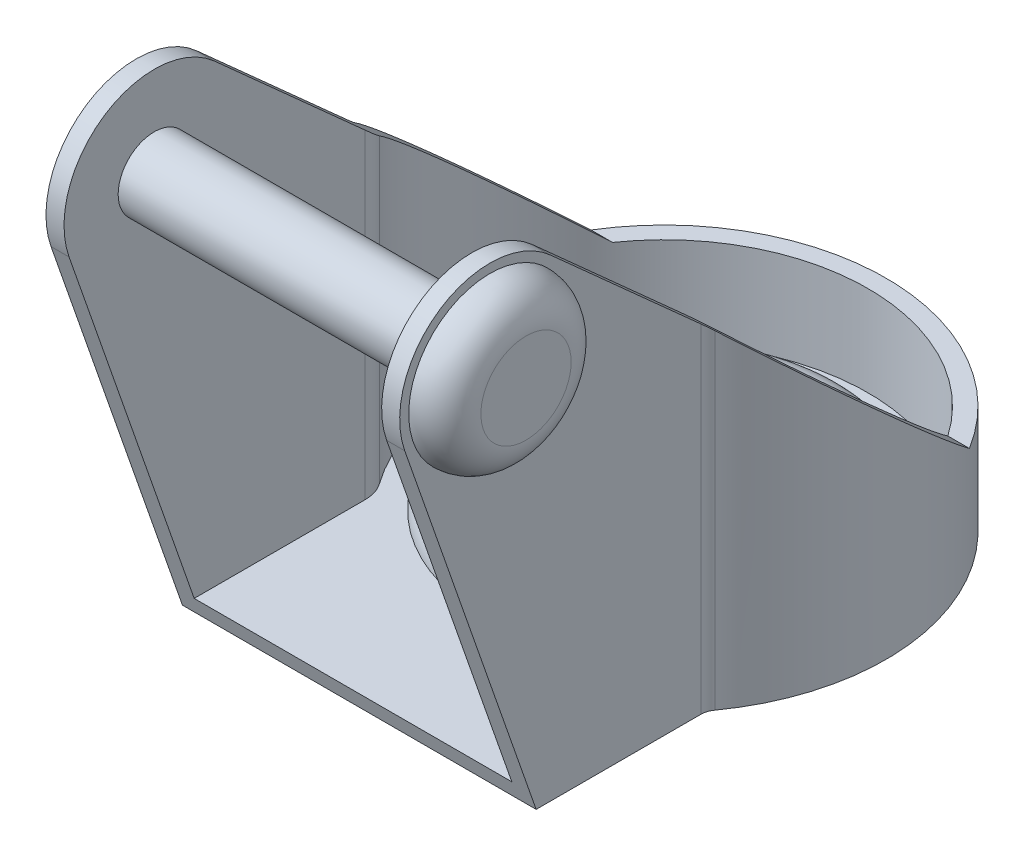
from build123d import *

# Parameters (mm, degrees)
BOSS_EXTRUDE3_DEPTH     = 1
BOSS_EXTRUDE4_DEPTH     = 19.6
CUT_EXTRUDE3_START      = -1
CUT_EXTRUDE3_DEPTH      = 38.799803657
BOSS_EXTRUDE5_DEPTH     = 30
CUT_EXTRUDE4_DEPTH      = 42.354259319
CUT_EXTRUDE4_DEPTH_BACK = 42.354259319
SKETCH9_R               = 2
BOSS_EXTRUDE6_DEPTH     = 17.6
SKETCH10_R              = 3.55
BOSS_EXTRUDE7_DEPTH     = 1
SKETCH11_R              = 1.8
CUT_EXTRUDE5_DEPTH      = 2
SKETCH12_R              = 4.5
BOSS_EXTRUDE8_DEPTH     = 2
SKETCH13_R              = 10.05
SKETCH13_R_2            = 5.1
BOSS_EXTRUDE9_DEPTH     = 2
SKETCH14_R              = 2.6
CUT_EXTRUDE6_DEPTH      = 39.097569002
FILLET2_R               = 2
FILLET3_R               = 2
FILLET4_R               = 2
FILLET5_R               = 2


# Some blends are built 0.0001 mm under size
with BuildPart() as part:
    # Sketch1 → Boss-Extrude3 (new body)
    # profile 1 of 2: a face of its own
    with BuildSketch(Plane(origin=(0, 0, 0), x_dir=(1, 0, 0), z_dir=(0, 1, 0))):
        with BuildLine():
            Line((9.8, -7.762087348), (9.8, -16.888723439))
            Line((9.8, -16.888723439), (-9.8, -16.888723439))
            Line((-9.8, -16.888723439), (-9.8, -7.762087348))
            ThreePointArc((-9.8, -7.762087348), (-9.848151778, -7.455517678), (-9.987969925, -7.178471758))
            ThreePointArc((-9.987969925, -7.178471758), (0, 12.3), (9.987969925, -7.178471758))
            ThreePointArc((9.987969925, -7.178471758), (9.848151778, -7.455517678), (9.8, -7.762087348))
        make_face()
        with BuildLine():
            ThreePointArc((8.8, -7.762087348), (8.896303556, -7.148948009), (9.17593985, -6.594856168))
            ThreePointArc((9.17593985, -6.594856168), (0, 11.3), (-9.17593985, -6.594856168))
            ThreePointArc((-9.17593985, -6.594856168), (-8.896303556, -7.148948009), (-8.8, -7.762087348))
            Line((-8.8, -7.762087348), (-8.8, -15.888723439))
            Line((-8.8, -15.888723439), (8.8, -15.888723439))
            Line((8.8, -15.888723439), (8.8, -7.762087348))
        make_face(mode=Mode.SUBTRACT)
    # profile 2 of 2: a face of its own
    with BuildSketch(Plane(origin=(0, 0, 0), x_dir=(1, 0, 0), z_dir=(0, 1, 0))):
        with BuildLine():
            Line((8.8, -7.762087348), (8.8, -15.888723439))
            Line((8.8, -15.888723439), (-8.8, -15.888723439))
            Line((-8.8, -15.888723439), (-8.8, -7.762087348))
            ThreePointArc((-8.8, -7.762087348), (-8.896303556, -7.148948009), (-9.17593985, -6.594856168))
            ThreePointArc((-9.17593985, -6.594856168), (0, 11.3), (9.17593985, -6.594856168))
            ThreePointArc((9.17593985, -6.594856168), (8.896303556, -7.148948009), (8.8, -7.762087348))
        make_face()
    extrude(amount=BOSS_EXTRUDE3_DEPTH)

    # Sketch2 → Boss-Extrude4 (add)
    with BuildSketch(Plane.ZY.offset(9.8)):
        with BuildLine():
            Line((16.888723439, 0), (24.17200628, 20.851200177))
            ThreePointArc((24.17200628, 20.851200177), (22.22483795, 26.660481625), (16.113586017, 26.22251443))
            Line((16.113586017, 26.22251443), (7.762087348, 18.73346191))
            Line((7.762087348, 18.73346191), (7.762087348, 0))
            Line((7.762087348, 0), (16.888723439, 0))
        make_face()
    extrude(amount=-BOSS_EXTRUDE4_DEPTH)

    # Sketch4 → Cut-Extrude3 (cut, through all)
    with BuildSketch(Plane.XZ.offset(CUT_EXTRUDE3_START)):
        Polygon((8.8, 7.762087348), (8.8, 15.888723439), (8.8, 29.007134954), (-8.8, 29.007134954), (-8.8, 15.888723439), (-8.8, 7.762087348), align=None)
    extrude(amount=-CUT_EXTRUDE3_DEPTH, mode=Mode.SUBTRACT)

    # Sketch5 → Boss-Extrude5 (add)
    with BuildSketch(Plane(origin=(0, 1, 0), x_dir=(1, 0, 0), z_dir=(0, 1, 0))):
        with BuildLine():
            Line((-8.8, -7.762087348), (-9.8, -7.762087348))
            ThreePointArc((-9.8, -7.762087348), (-9.848151778, -7.455517678), (-9.987969925, -7.178471758))
            ThreePointArc((-9.987969925, -7.178471758), (0, 12.3), (9.987969925, -7.178471758))
            ThreePointArc((9.987969925, -7.178471758), (9.848151778, -7.455517678), (9.8, -7.762087348))
            Line((9.8, -7.762087348), (8.8, -7.762087348))
            ThreePointArc((8.8, -7.762087348), (8.896303556, -7.148948009), (9.17593985, -6.594856168))
            ThreePointArc((9.17593985, -6.594856168), (0, 11.3), (-9.17593985, -6.594856168))
            ThreePointArc((-9.17593985, -6.594856168), (-8.896303556, -7.148948009), (-8.8, -7.762087348))
        make_face()
    extrude(amount=BOSS_EXTRUDE5_DEPTH)

    # Sketch7 → Cut-Extrude4 (cut, two sides: drawn at the far end of the back side and taken through both)
    with BuildSketch(Plane(origin=(0, 0, 0), x_dir=(0, 0, -1), z_dir=(1, 0, 0)).offset(-CUT_EXTRUDE4_DEPTH_BACK)):
        Polygon((15.143665649, 54.023758671), (-16.113586017, 54.023758671), (-16.113586017, 26.22251443), (-7.762087348, 18.73346191), (6.433392437, 6.003927025), (15.143665649, 6.003927025), align=None)
    extrude(amount=CUT_EXTRUDE4_DEPTH + CUT_EXTRUDE4_DEPTH_BACK, mode=Mode.SUBTRACT)

    # Sketch9 → Boss-Extrude6 (add)
    with BuildSketch(Plane(origin=(-8.8, 0, 0), x_dir=(0, 0, -1), z_dir=(1, 0, 0))):
        with Locations(Location((-19.451682229, 22.5, 0), (0, 0, 180))):
            Circle(SKETCH9_R)
    extrude(amount=BOSS_EXTRUDE6_DEPTH)

    # Sketch10 → Boss-Extrude7 (add)
    with BuildSketch(Plane.ZY.offset(9.8)):
        with Locations(Location((19.451682229, 22.5, 0), (0, 0, 180))):
            Circle(SKETCH10_R)
    extrude(amount=BOSS_EXTRUDE7_DEPTH)

    # Sketch11 → Cut-Extrude5 (cut)
    with BuildSketch(Plane.ZY.offset(10.8)):
        with Locations((19.451682229, 22.5)):
            Circle(SKETCH11_R)
    extrude(amount=-CUT_EXTRUDE5_DEPTH, mode=Mode.SUBTRACT)

    # Sketch12 → Boss-Extrude8 (add)
    with BuildSketch(Plane(origin=(9.8, 0, 0), x_dir=(0, 0, -1), z_dir=(1, 0, 0))):
        with Locations((-19.451682229, 22.5)):
            Circle(SKETCH12_R)
    extrude(amount=BOSS_EXTRUDE8_DEPTH)

    # Sketch13 → Boss-Extrude9 (add)
    with BuildSketch(Plane(origin=(0, 1, 0), x_dir=(1, 0, 0), z_dir=(0, 1, 0))):
        with Locations(Location((0, 0, 0), (0, 0, 270))):
            Circle(SKETCH13_R)
        with Locations(Location((0, 0, 0), (0, 0, 270))):
            Circle(SKETCH13_R_2, mode=Mode.SUBTRACT)
    extrude(amount=BOSS_EXTRUDE9_DEPTH)

    # Sketch14 → Cut-Extrude6 (cut, through all)
    with BuildSketch(Plane(origin=(0, 1, 0), x_dir=(1, 0, 0), z_dir=(0, 1, 0))):
        with Locations(Location((0, 0, 0), (0, 0, 270))):
            Circle(SKETCH14_R)
    extrude(amount=-CUT_EXTRUDE6_DEPTH, mode=Mode.SUBTRACT)

    # Fillet2
    fillet2_edges = [part.edges().sort_by_distance(p)[0] for p in [
        (0, 3, -5.1),
    ]]
    fillet(fillet2_edges, radius=FILLET2_R - 0.0001)  # a hair under: the kernel refuses the full size

    # Fillet3
    fillet3_edges = [part.edges().sort_by_distance(p)[0] for p in [
        (0, 3, -10.05),
    ]]
    fillet(fillet3_edges, radius=FILLET3_R - 0.0001)  # a hair under: the kernel refuses the full size

    # Fillet4
    # the kernel refuses this fillet: 2 mm, written as the material it takes off along each edge
    with BuildSketch(Plane(origin=(-10.8, 22.5, 19.451682229), x_dir=(0, 0, -1), z_dir=(0, 1, 0))) as fillet4_piece_1:
        with BuildLine():
            CenterArc((1.817949192, -2), FILLET4_R, 30, 60)
            Line((1.817949192, 0), (1.817949192, 0.04))
            Line((1.817949192, 0.04), (3.55, 0.04))
            Line((3.55, 0.04), (3.59, 0))
            ThreePointArc((3.59, 0), (3.59, -0.5), (3.584641016, -0.98))
            Line((3.584641016, -0.98), (3.55, -1))
        make_face()
    revolve(axis=Axis((-10.8, 22.5, 19.451682229), (-1, 0, 0)), mode=Mode.SUBTRACT)

    # Fillet5
    fillet5_edges = [part.edges().sort_by_distance(p)[0] for p in [
        (11.8, 22.5, 23.951682229),
    ]]
    fillet(fillet5_edges, radius=FILLET5_R - 0.0001)  # a hair under: the kernel refuses the full size


solid = part.part
